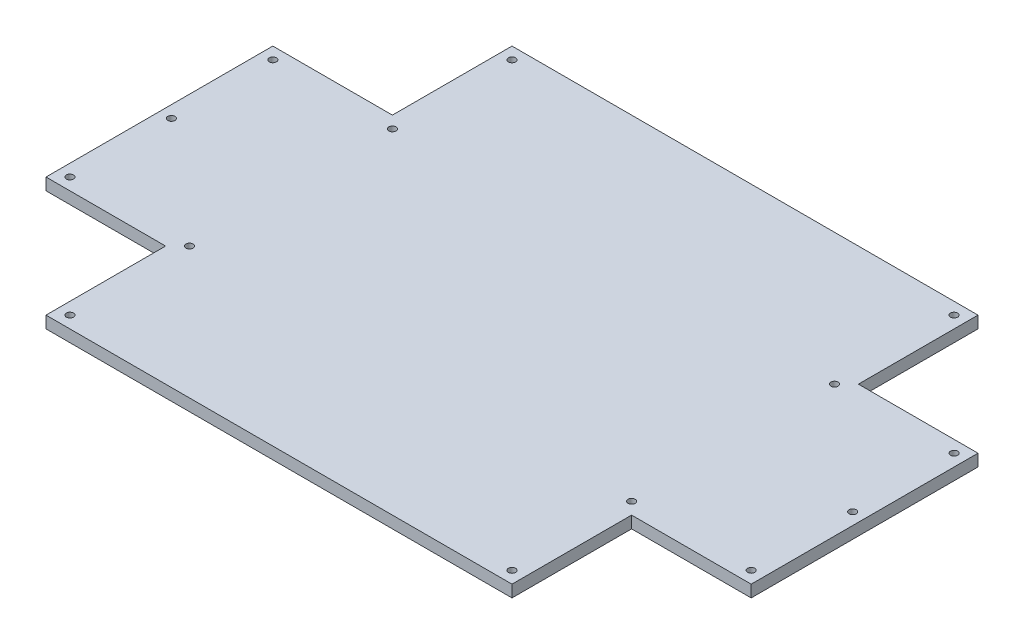
from build123d import *

# Parameters (mm, degrees)
ESQUISSE1_R        = 1.5
BOSS_EXTRU_1_DEPTH = 5


with BuildPart() as part:
    # Esquisse1 → Boss.-Extru.1 (new body)
    with BuildSketch(Plane(origin=(0, 0, 0), x_dir=(1, 0, 0), z_dir=(0, 1, 0))):
        Polygon((-147.415, 47.415), (-97.415, 47.415), (-97.415, 97.415), (97.415, 97.415), (97.415, 47.415), (147.415, 47.415), (147.415, -47.415), (97.415, -47.415), (97.415, -97.415), (-97.415, -97.415), (-97.415, -47.415), (-147.415, -47.415), align=None)
        with Locations((-92.415, 42.415)):
            Circle(ESQUISSE1_R, mode=Mode.SUBTRACT)
        with Locations((-142.415, 42.415)):
            Circle(ESQUISSE1_R, mode=Mode.SUBTRACT)
        with Locations((-142.415, 0)):
            Circle(ESQUISSE1_R, mode=Mode.SUBTRACT)
        with Locations((-142.415, -42.415)):
            Circle(ESQUISSE1_R, mode=Mode.SUBTRACT)
        with Locations((-92.415, -42.415)):
            Circle(ESQUISSE1_R, mode=Mode.SUBTRACT)
        with Locations((-92.415, -92.415)):
            Circle(ESQUISSE1_R, mode=Mode.SUBTRACT)
        with Locations((-92.415, 92.415)):
            Circle(ESQUISSE1_R, mode=Mode.SUBTRACT)
        with Locations((92.415, -92.415)):
            Circle(ESQUISSE1_R, mode=Mode.SUBTRACT)
        with Locations((92.415, -42.415)):
            Circle(ESQUISSE1_R, mode=Mode.SUBTRACT)
        with Locations((142.415, -42.415)):
            Circle(ESQUISSE1_R, mode=Mode.SUBTRACT)
        with Locations((142.415, 0)):
            Circle(ESQUISSE1_R, mode=Mode.SUBTRACT)
        with Locations((142.415, 42.415)):
            Circle(ESQUISSE1_R, mode=Mode.SUBTRACT)
        with Locations((92.415, 42.415)):
            Circle(ESQUISSE1_R, mode=Mode.SUBTRACT)
        with Locations((92.415, 92.415)):
            Circle(ESQUISSE1_R, mode=Mode.SUBTRACT)
    extrude(amount=BOSS_EXTRU_1_DEPTH)


solid = part.part
